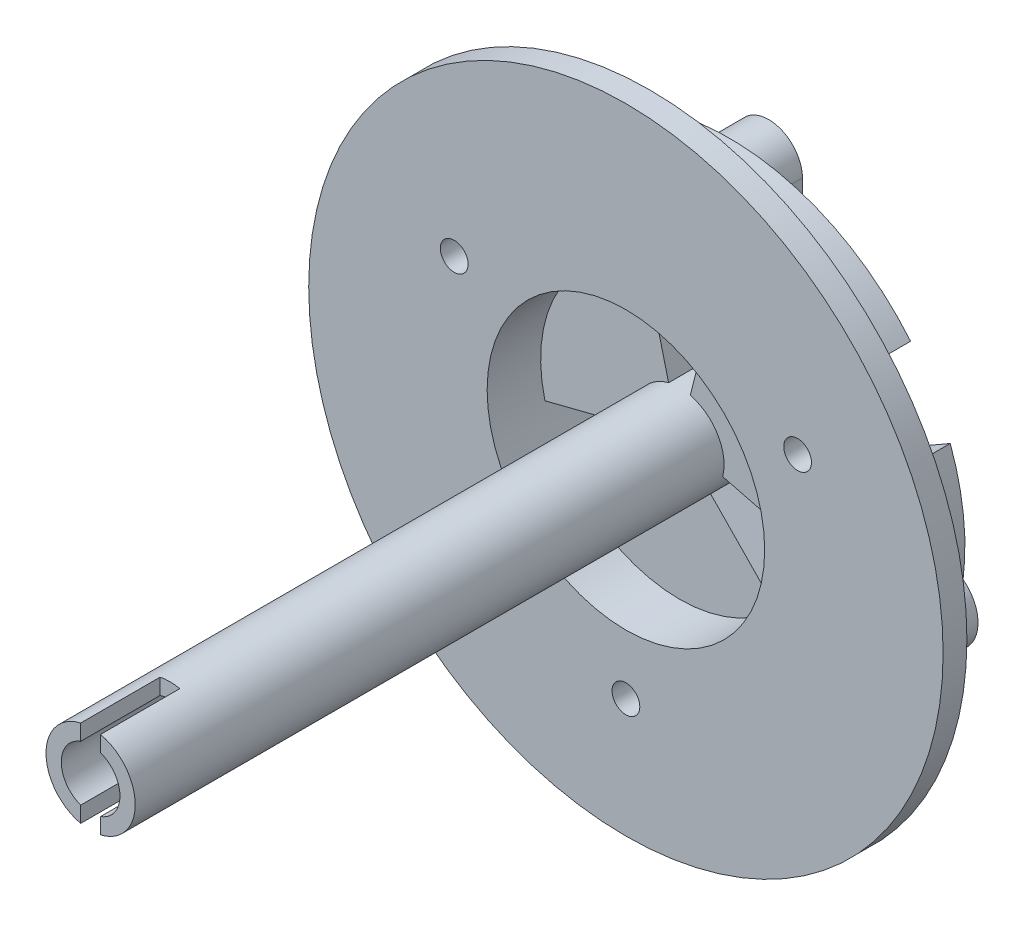
from build123d import *
from build123d.topology import SkipClean

# Parameters (mm, degrees)
SKETCH_1_R          = 16
EXTRUDE_1_DEPTH     = 1.2
SKETCH_2_R          = 7
CUT_EXTRUDE_1_DEPTH = 1.2
SKETCH_3_R          = 0.7
CUT_EXTRUDE_2_DEPTH = 1.2
SKETCH_4_R          = 0.9
EXTRUDE_2_DEPTH     = 6
SKETCH_5_R          = 7
CUT_EXTRUDE_3_DEPTH = 11
SKETCH_6_R          = 11.9
SKETCH_6_R_2        = 7
EXTRUDE_3_DEPTH     = 4
SKETCH_7_R          = 0.7
CUT_EXTRUDE_4_DEPTH = 13
SKETCH_8_R          = 2.25
EXTRUDE_4_DEPTH     = 33
EXTRUDE_START       = -2.5
EXTRUDE_5_DEPTH     = 2.5
SKETCH_10_R         = 1.5
CUT_EXTRUDE_5_DEPTH = 33.5
SKETCH_12_W         = 13.813743992
SKETCH_12_H         = 10.461201588
CUT_EXTRUDE_6_DEPTH = 16.75
SKETCH_13_R         = 2
CUT_EXTRUDE_7_DEPTH = 1.5
SKETCH_14_R         = 2.25
SKETCH_14_R_2       = 1.5
EXTRUDE_6_DEPTH     = 8.25
CUT_EXTRUDE_9_DEPTH = 1.5
EXTRUDE_START_2     = -32.2
SKETCH_17_R         = 1.5
SKETCH_17_R_2       = 1.48
EXTRUDE_7_DEPTH     = 32.2
CUT_EXTRUDE_8_DEPTH = 4


with BuildPart() as part:
    # 草图1 → 凸台-拉伸1 (new body)
    with BuildSketch(Plane.XY):
        Circle(SKETCH_1_R)
    extrude(amount=EXTRUDE_1_DEPTH)

    # 草图2 → 切除-拉伸1 (cut)
    with BuildSketch(Plane.XY.offset(1.2)):
        Circle(SKETCH_2_R)
    extrude(amount=-CUT_EXTRUDE_1_DEPTH, mode=Mode.SUBTRACT)

    # 草图3 → 切除-拉伸2 (cut)
    with BuildSketch(Plane.XY.offset(1.2)):
        with Locations((8.660254038, 5)):
            Circle(SKETCH_3_R)
        with Locations((0, -10)):
            Circle(SKETCH_3_R)
        with Locations((-8.660254038, 5)):
            Circle(SKETCH_3_R)
    extrude(amount=-CUT_EXTRUDE_2_DEPTH, mode=Mode.SUBTRACT)

    # 草图4 → 凸台-拉伸2 (add)
    # profile 1 of 3: a face of its own
    with BuildSketch(Plane(origin=(0, 0, 0), x_dir=(-1, 0, 0), z_dir=(0, 0, -1))):
        with BuildLine():
            Line((1.703894623, 10), (1.703894623, 5.395195442))
            Line((1.703894623, 5.395195442), (-1.703894623, 5.395195442))
            Line((-1.703894623, 5.395195442), (-1.703894623, 10))
            ThreePointArc((-1.703894623, 10), (0, 11.703894623), (1.703894623, 10))
        make_face()
        with Locations((0, 10)):
            Circle(SKETCH_4_R, mode=Mode.SUBTRACT)
    # profile 2 of 3: a face of its own
    with BuildSketch(Plane(origin=(0, 0, 0), x_dir=(-1, 0, 0), z_dir=(0, 0, -1))):
        with BuildLine():
            Line((-5.537946003, -1.003403593), (-3.637946003, -4.294300127))
            Line((-3.637946003, -4.294300127), (-7.710254038, -6.645448267))
            ThreePointArc((-7.710254038, -6.645448267), (-10.305702305, -5.95), (-9.610254038, -3.354551733))
            Line((-9.610254038, -3.354551733), (-5.537946003, -1.003403593))
        make_face()
        with Locations((-8.660254038, -5)):
            Circle(SKETCH_4_R, mode=Mode.SUBTRACT)
    # profile 3 of 3: a face of its own
    with BuildSketch(Plane(origin=(0, 0, 0), x_dir=(-1, 0, 0), z_dir=(0, 0, -1))):
        with BuildLine():
            Line((3.637946003, -4.294300127), (5.537946003, -1.003403593))
            Line((5.537946003, -1.003403593), (9.610254038, -3.354551733))
            ThreePointArc((9.610254038, -3.354551733), (10.305702305, -5.95), (7.710254038, -6.645448267))
            Line((7.710254038, -6.645448267), (3.637946003, -4.294300127))
        make_face()
        with Locations((8.660254038, -5)):
            Circle(SKETCH_4_R, mode=Mode.SUBTRACT)
    extrude(amount=EXTRUDE_2_DEPTH)

    # 草图5 → 切除-拉伸3 (cut)
    with BuildSketch(Plane.XY.offset(1.2)):
        Circle(SKETCH_5_R)
    extrude(amount=-CUT_EXTRUDE_3_DEPTH, mode=Mode.SUBTRACT)

    # 草图6 → 凸台-拉伸3 (add)
    with SkipClean():  # the faces are left unmerged after this step: merging them gives an invalid solid
        with BuildSketch(Plane(origin=(0, 0, 0), x_dir=(-1, 0, 0), z_dir=(0, 0, -1))):
            Circle(SKETCH_6_R)
            Circle(SKETCH_6_R_2, mode=Mode.SUBTRACT)
        extrude(amount=EXTRUDE_3_DEPTH)

    # 草图7 → 切除-拉伸4 (cut)
    with SkipClean():  # the faces are left unmerged after this step: merging them gives an invalid solid
        with BuildSketch(Plane.XY.offset(1.2)):
            with Locations((-8.660254038, 5)):
                Circle(SKETCH_7_R)
            with Locations((8.660254038, 5)):
                Circle(SKETCH_7_R)
            with Locations((0, -10)):
                Circle(SKETCH_7_R)
        extrude(amount=-CUT_EXTRUDE_4_DEPTH, mode=Mode.SUBTRACT)



with BuildPart() as body_2:
    # 草图8 → 凸台-拉伸4 (new body)
    with BuildSketch(Plane(origin=(0, 0, -4), x_dir=(-1, 0, 0), z_dir=(0, 0, -1))):
        Circle(SKETCH_8_R)
    extrude(amount=-EXTRUDE_4_DEPTH)


with BuildPart() as part_1:
    with SkipClean():  # the faces are left unmerged after this step: merging them gives an invalid solid
        add(part.part)

        add(body_2.part)  # 凸台-拉伸5 merges body 2
        # 草图9 → 凸台-拉伸5 (add)
        with BuildSketch(Plane(origin=(0, 0, -4), x_dir=(-1, 0, 0), z_dir=(0, 0, -1)).offset(EXTRUDE_START)):
            with BuildLine():
                Line((-1.570048426, -1.611659996), (-4.884595102, -5.01405332))
                ThreePointArc((-4.884595102, -5.01405332), (0, -7), (4.884595102, -5.01405332))
                Line((4.884595102, -5.01405332), (1.570048426, -1.611659996))
                ThreePointArc((1.570048426, -1.611659996), (0, -2.25), (-1.570048426, -1.611659996))
            make_face()
            with BuildLine():
                Line((-2.180762711, -0.553871824), (-6.784595102, -1.723156785))
                ThreePointArc((-6.784595102, -1.723156785), (-6.010804278, 3.587510548), (-1.703894623, 6.789458234))
                Line((-1.703894623, 6.789458234), (-0.547680415, 2.182325861))
                ThreePointArc((-0.547680415, 2.182325861), (-1.932044232, 1.15312839), (-2.180762711, -0.553871824))
            make_face()
            with BuildLine():
                Line((0.547680415, 2.182325861), (1.703894623, 6.789458234))
                ThreePointArc((1.703894623, 6.789458234), (6.010804278, 3.587510548), (6.784595102, -1.723156785))
                Line((6.784595102, -1.723156785), (2.180762711, -0.553871824))
                ThreePointArc((2.180762711, -0.553871824), (1.932044232, 1.15312839), (0.547680415, 2.182325861))
            make_face()
        extrude(amount=EXTRUDE_5_DEPTH)

    # 草图10 → 切除-拉伸5 (cut)
    with SkipClean():  # the faces are left unmerged after this step: merging them gives an invalid solid
        with BuildSketch(Plane(origin=(0, 0, -4), x_dir=(-1, 0, 0), z_dir=(0, 0, -1))):
            Circle(SKETCH_10_R)
        extrude(amount=-CUT_EXTRUDE_5_DEPTH, mode=Mode.SUBTRACT)

    # 草图12 → 切除-拉伸6 (cut, symmetric)
    with SkipClean():  # the faces are left unmerged after this step: merging them gives an invalid solid
        with BuildSketch(Plane(origin=(0, 0, 0), x_dir=(0, 0, -1), z_dir=(1, 0, 0))):
            with Locations((-26.856871996, 0.140862114)):
                Rectangle(SKETCH_12_W, SKETCH_12_H)
        extrude(amount=CUT_EXTRUDE_6_DEPTH, both=True, mode=Mode.SUBTRACT)

    # 草图13 → 切除-拉伸7 (cut)
    with SkipClean():  # the faces are left unmerged after this step: merging them gives an invalid solid
        with BuildSketch(Plane(origin=(0, 0, -4), x_dir=(-1, 0, 0), z_dir=(0, 0, -1))):
            with Locations((0, -10)):
                Circle(SKETCH_13_R)
            with Locations((8.660254038, 5)):
                Circle(SKETCH_13_R)
            with Locations((-8.660254038, 5)):
                Circle(SKETCH_13_R)
        extrude(amount=-CUT_EXTRUDE_7_DEPTH, mode=Mode.SUBTRACT)

    # 草图14 → 凸台-拉伸6 (add)
    with SkipClean():  # the faces are left unmerged after this step: merging them gives an invalid solid
        with BuildSketch(Plane.XY.offset(19.95)):
            Circle(SKETCH_14_R)
            Circle(SKETCH_14_R_2, mode=Mode.SUBTRACT)
        extrude(amount=EXTRUDE_6_DEPTH)

    # 草图16 → 切除-拉伸9 (cut)
    with SkipClean():  # the faces are left unmerged after this step: merging them gives an invalid solid
        with BuildSketch(Plane(origin=(0, 0, -4), x_dir=(-1, 0, 0), z_dir=(0, 0, -1))):
            Polygon((0, -10), (-2, -10), (-2, -14.130337011), (2, -14.130337011), (2, -10), align=None)
            Polygon((-9.660254038, 3.267949192), (-8.660254038, 5), (-7.660254038, 6.732050808), (-11.237230815, 8.797219313), (-13.237230815, 5.333117698), align=None)
            Polygon((7.660254038, 6.732050808), (8.660254038, 5), (9.660254038, 3.267949192), (13.237230815, 5.333117698), (11.237230815, 8.797219313), align=None)
        extrude(amount=-CUT_EXTRUDE_9_DEPTH, mode=Mode.SUBTRACT)

    # 草图17 → 凸台-拉伸7 (add)
    with SkipClean():  # the faces are left unmerged after this step: merging them gives an invalid solid
        with BuildSketch(Plane.XY.offset(28.2).offset(EXTRUDE_START_2)):
            Circle(SKETCH_17_R)
            Circle(SKETCH_17_R_2, mode=Mode.SUBTRACT)
        extrude(amount=EXTRUDE_7_DEPTH)

    # 草图15 → 切除-拉伸8 (cut)
    with SkipClean():  # the faces are left unmerged after this step: merging them gives an invalid solid
        with BuildSketch(Plane.XY.offset(28.2)):
            Polygon((0.5, 0), (0.5, 3.091484403), (-0.5, 3.091484403), (-0.5, -2.900632705), (0.5, -2.900632705), align=None)
        extrude(amount=-CUT_EXTRUDE_8_DEPTH, mode=Mode.SUBTRACT)


solid = part_1.part
